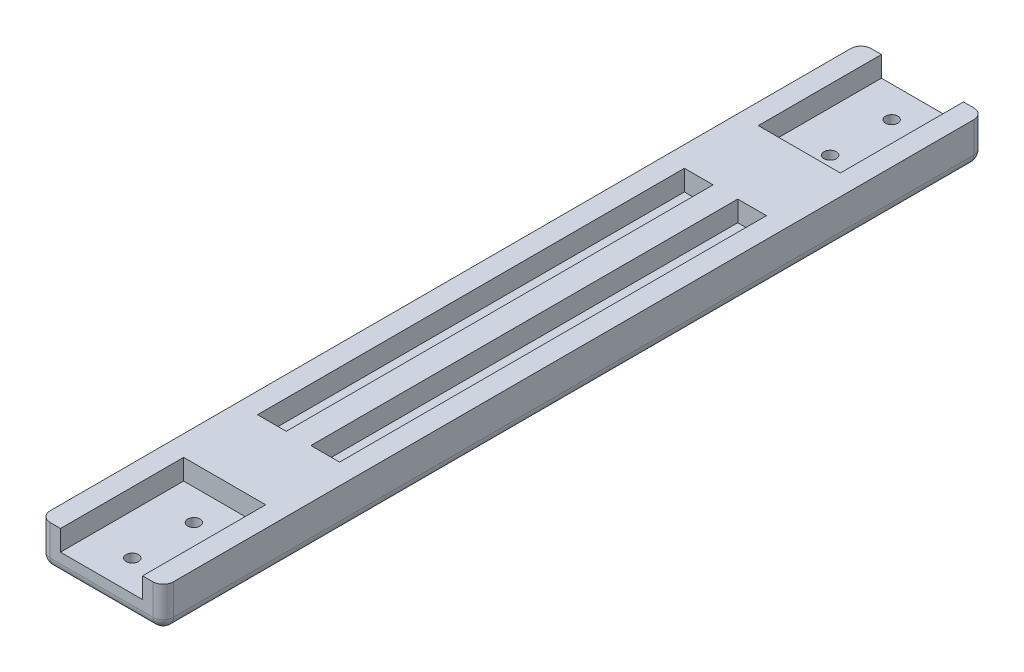
from build123d import *

# Parameters (mm, degrees)
SKETCH2_W             = 30
SKETCH2_H             = 200
BOSS_EXTRUDE1_DEPTH   = 10
SKETCH3_W             = 20
SKETCH3_H             = 30
SKETCH3_W_2           = 7
SKETCH3_H_2           = 104
CUT_EXTRUDE1_DEPTH    = 5
FILLET1_R             = 2.5
FILLET2_R             = 2.5
SKETCH4_W             = 3
SKETCH4_H             = 100
CUT_EXTRUDE2_DEPTH    = 10
FILLET3_R             = 1.5
F_3_0MM_DOWEL_HOLE1_D = 3


with BuildPart() as part:
    # Sketch2 → Boss-Extrude1 (new body)
    with BuildSketch(Plane(origin=(0, 0, 0), x_dir=(1, 0, 0), z_dir=(0, 1, 0))):
        Rectangle(SKETCH2_W, SKETCH2_H)
    extrude(amount=BOSS_EXTRUDE1_DEPTH)

    # Sketch3 → Cut-Extrude1 (cut)
    with BuildSketch(Plane(origin=(0, 10, 0), x_dir=(1, 0, 0), z_dir=(0, 1, 0))):
        with Locations((0, 85)):
            Rectangle(SKETCH3_W, SKETCH3_H)
        with Locations((0, -85)):
            Rectangle(SKETCH3_W, SKETCH3_H)
        with Locations((6.5, 0)):
            Rectangle(SKETCH3_W_2, SKETCH3_H_2)
        with Locations((-6.5, 0)):
            Rectangle(SKETCH3_W_2, SKETCH3_H_2)
    extrude(amount=-CUT_EXTRUDE1_DEPTH, mode=Mode.SUBTRACT)

    # Fillet1
    fillet1_edges = [part.edges().sort_by_distance(p)[0] for p in [
        (15, 5, 100),
        (-15, 5, 100),
        (-15, 5, -100),
        (15, 5, -100),
    ]]
    fillet(fillet1_edges, radius=FILLET1_R)

    # Fillet2
    fillet2_edges = [part.edges().sort_by_distance(p)[0] for p in [
        (0, 0, 100),
        (15, 0, 0),
        (-15, 0, 0),
        (0, 0, -100),
        (14.267766953, 0, -99.267766953),
        (-14.267766953, 0, -99.267766953),
        (14.267766953, 0, 99.267766953),
        (-14.267766953, 0, 99.267766953),
    ]]
    fillet(fillet2_edges, radius=FILLET2_R)

    # Sketch4 → Cut-Extrude2 (cut)
    with BuildSketch(Plane(origin=(0, 10, 0), x_dir=(1, 0, 0), z_dir=(0, 1, 0))):
        with Locations((6.5, 0)):
            Rectangle(SKETCH4_W, SKETCH4_H)
        with Locations((-6.5, 0)):
            Rectangle(SKETCH4_W, SKETCH4_H)
    extrude(amount=-CUT_EXTRUDE2_DEPTH, mode=Mode.SUBTRACT)

    # Fillet3
    fillet3_edges = [part.edges().sort_by_distance(p)[0] for p in [
        (5, 2.5, 50),
        (8, 2.5, 50),
        (5, 2.5, -50),
        (8, 2.5, -50),
        (-5, 2.5, 50),
        (-8, 2.5, 50),
        (-8, 2.5, -50),
        (-5, 2.5, -50),
    ]]
    fillet(fillet3_edges, radius=FILLET3_R - 0.0001)  # a hair under: the kernel refuses the full size

    # Ø3.0mm Dowel Hole1 (through all)
    with Locations(Plane(origin=(0, 5, 0), x_dir=(1, 0, 0), z_dir=(0, 1, 0))):
        with Locations((0, 92.5), (0, 77.5), (0, -77.5), (0, -92.5)):
            Hole(F_3_0MM_DOWEL_HOLE1_D / 2)


solid = part.part
